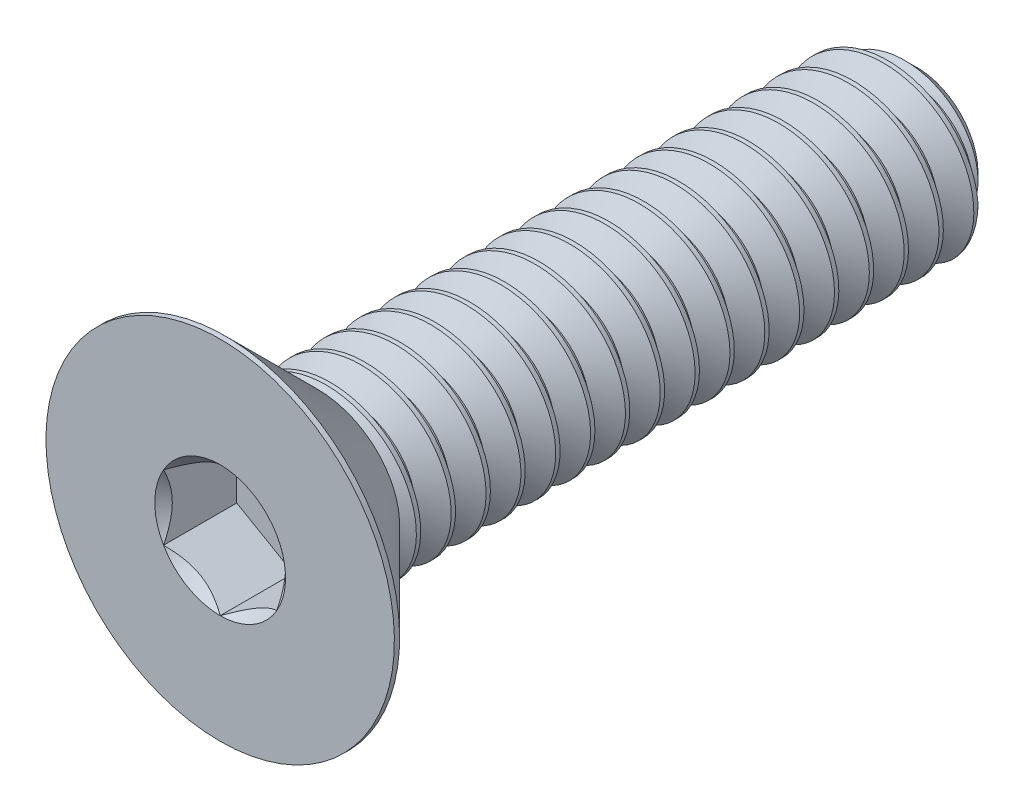
from build123d import *

# Parameters (mm, degrees)
CHAMFER1_SIZE      = 0.3
CUT_EXTRUDE2_DEPTH = 0.84
CUT_SWEEP1_PITCH   = 0.4


with BuildPart() as part:
    # Sketch1 → Revolve1 (revolve)
    with BuildSketch(Plane(origin=(0, 0, 0), x_dir=(0, 0, -1), z_dir=(1, 0, 0)), mode=Mode.PRIVATE) as revolve1_sk:
        Polygon((-2.8, 1), (4, 1), (4, 0), (-3.16, 0), (-3.16, 1), align=None)
    revolve(revolve1_sk.sketch.rotate(Axis((0, 0, 3.16), (0, 0, -1)), 180), axis=Axis((0, 0, 3.16), (0, 0, -1)))

    # Chamfer1
    chamfer1_edges = [part.edges().sort_by_distance(p)[0] for p in [
        (0, 1, -4),
    ]]
    chamfer(chamfer1_edges, length=CHAMFER1_SIZE)

    # Cut-Sweep1: the profile of Sketch13 screwed along a right-hand helix of 20 turns, 6 arcs to a turn; built about Z, then put on its axis
    cut_sweep1_z = Axis((0, 0, 0), (0, 0, 1))
    cut_sweep1_corners = [(1.021650635, 0, 0.0125), (1.021650635, 0, -0.3625), (0.740192379, 0, -0.2), (0.740192379, 0, -0.15)]
    with BuildLine(mode=Mode.PRIVATE) as cut_sweep1_profile:
        Line(cut_sweep1_corners[0], cut_sweep1_corners[1])
        Line(cut_sweep1_corners[1], cut_sweep1_corners[2])
        Line(cut_sweep1_corners[2], cut_sweep1_corners[3])
        Line(cut_sweep1_corners[3], cut_sweep1_corners[0])
    cut_sweep1_cap = Face(cut_sweep1_profile.wire())
    cut_sweep1_turn_angles = [0, 30, 60, 90, 120, 150, 180, 210, 240, 270, 300, 330, 360]
    cut_sweep1_turn_weights = [1, 0.8660254037844387, 1, 0.8660254037844387, 1, 0.8660254037844387, 1, 0.8660254037844387, 1, 0.8660254037844387, 1, 0.8660254037844387, 1]
    cut_sweep1_turn_rails = [Edge.make_bspline([Vector(p[0], p[1], 0).rotate(cut_sweep1_z, cut_sweep1_turn_angles[k]) / cut_sweep1_turn_weights[k] + Vector(0, 0, p[2] + CUT_SWEEP1_PITCH * cut_sweep1_turn_angles[k] / 360) for k in range(13)], [0, 0, 0, 1, 1, 2, 2, 3, 3, 4, 4, 5, 5, 6, 6, 6], 2, cut_sweep1_turn_weights) for p in cut_sweep1_corners]
    cut_sweep1_turn_sides = [Face.make_surface_from_curves(cut_sweep1_turn_rails[p[0]], cut_sweep1_turn_rails[p[1]]) for p in [(0, 1), (1, 2), (2, 3), (3, 0)]]
    cut_sweep1 = Plane(origin=(0, 0, -4), x_dir=(0, 1, 0), z_dir=(0, 0, 1)) * Solid(Shell([*[p.moved(Location((0, 0, CUT_SWEEP1_PITCH * i))) for i in range(20) for p in cut_sweep1_turn_sides], cut_sweep1_cap, cut_sweep1_cap.rotate(cut_sweep1_z, 7200).moved(Location((0, 0, CUT_SWEEP1_PITCH * 7200 / 360)))]))
    add(cut_sweep1, mode=Mode.SUBTRACT)


with BuildPart() as body_2:
    # Sketch7 → Revolve2 (revolve)
    with BuildSketch(Plane(origin=(0, 0, 0), x_dir=(0, 0, -1), z_dir=(1, 0, 0)), mode=Mode.PRIVATE) as revolve2_sk:
        Polygon((-4, 2), (-3.94, 2), (-2.8, 0.86), (-2.8, 0), (-4, 0), align=None)
    revolve(revolve2_sk.sketch.rotate(Axis((0, 0, 4), (0, 0, -1)), 180), axis=Axis((0, 0, 4), (0, 0, -1)))

    # Sketch5 → Cut-Extrude2 (cut)
    with BuildSketch(Plane.XY.offset(4)):
        Polygon((0.65, -0.375277675), (0.65, 0.375277675), (0, 0.75055535), (-0.65, 0.375277675), (-0.65, -0.375277675), (0, -0.75055535), align=None)
    extrude(amount=-CUT_EXTRUDE2_DEPTH, mode=Mode.SUBTRACT)

    # Cut-Extrude3 cone 1 section (through the dimple's axis) → Cut-Extrude3 (revolve, cut)
    with BuildSketch(Plane(origin=(0, 0, 4), x_dir=(0, -1, 0), z_dir=(1, 0, 0))):
        Polygon((0, 0), (0.75055535, 0), (0, 0.75055535), align=None)
    revolve(axis=Axis((0, 0, 4), (0, 0, -1)), mode=Mode.SUBTRACT)

    # Combine1: union part
    add(part.part)


solid = body_2.part
